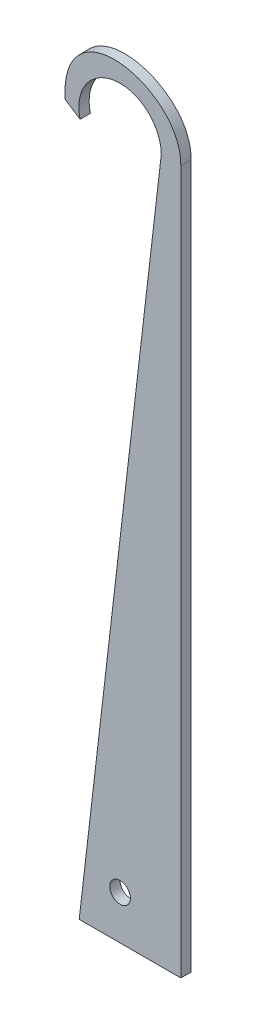
from build123d import *

# Parameters (mm, degrees)
SKETCH1_R           = 6.35
BOSS_EXTRUDE1_DEPTH = 6.35


with BuildPart() as part:
    # Sketch1 → Boss-Extrude1 (new body)
    with BuildSketch(Plane.XY):
        with BuildLine():
            ThreePointArc((-25.4, 0), (0, 25.4), (25.4, 0))
            Line((25.4, 0), (-25.173271775, -433.386841394))
            Line((-25.173271775, -433.386841394), (37.428770247, -433.386841394))
            Line((37.428770247, -433.386841394), (37.428770247, 0))
            add(Edge.make_bspline(
                [(-33.983006846, 0), (-36.516678882, 56.117898375), (38.120732656, 39.984383269), (37.428770247, 0)],
                knots=[0, 0, 0, 0, 1, 1, 1, 1], degree=3))
            Line((-33.983006846, 0), (-24.636131467, -6.182315611))
            ThreePointArc((-24.636131467, -6.182315611), (-25.208309535, -3.114663764), (-25.4, 0))
        make_face()
        with Locations((0, -406.4)):
            Circle(SKETCH1_R, mode=Mode.SUBTRACT)
    extrude(amount=BOSS_EXTRUDE1_DEPTH)


solid = part.part
